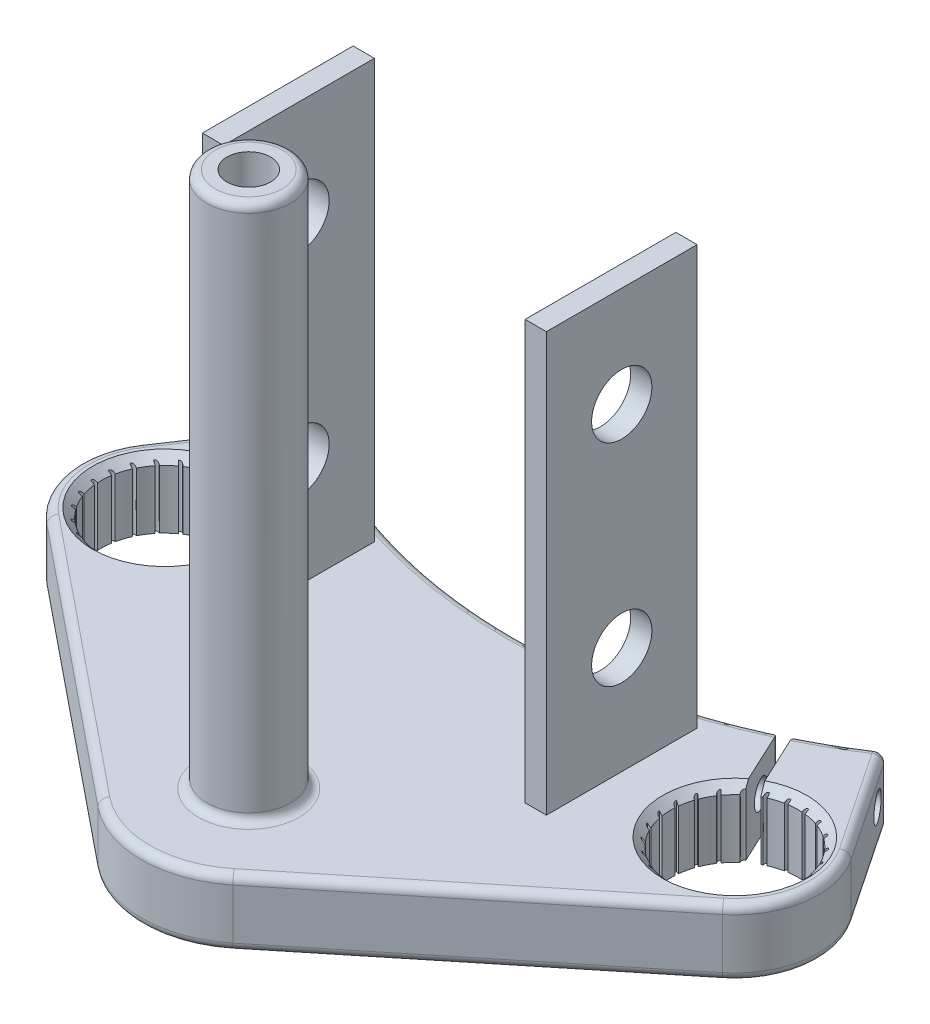
from build123d import *

# Parameters (mm, degrees)
BOSS_EXTRUDE1_DEPTH = 20
SKETCH2_R           = 12.5
BOSS_EXTRUDE2_DEPTH = 160
SKETCH4_W           = 6.35
SKETCH4_H           = 45
BOSS_EXTRUDE3_DEPTH = 125
HOLE1_START         = 155
HOLE1_OUTLINE_R     = 6.5
HOLE1_DEPTH         = 25
SKETCH7_R           = 4
CUT_EXTRUDE1_DEPTH  = 32
CHAMFER1_SIZE       = 2.5
SKETCH8_R           = 0.9
CUT_EXTRUDE2_DEPTH  = 215.909306453
CIRPATTERN1_DEPTH   = 18.399995043
SKETCH9_R           = 9
CUT_EXTRUDE3_DEPTH  = 259.708528077
FILLET1_R           = 2.5


# Read off the part's stored shape, not the designer's step: Hole1, CirPattern1
with BuildPart() as part:
    # Sketch1 → Boss-Extrude1 (new body)
    with BuildSketch(Plane(origin=(0, 0, 0), x_dir=(1, 0, 0), z_dir=(0, 1, 0))):
        with BuildLine():
            Line((100.846768223, -19.417499596), (20.155863325, -84.854399482))
            ThreePointArc((20.155863325, -84.854399482), (0, -92), (-20.155863325, -84.854399482))
            Line((-20.155863325, -84.854399482), (-100.846768223, -19.417499596))
            ThreePointArc((-100.846768223, -19.417499596), (-109.822166194, -3.716786069), (-105.860151048, 13.928967243))
            Line((-105.860151048, 13.928967243), (-84.688120838, 45.484396836))
            ThreePointArc((-84.688120838, 45.484396836), (-76.200585788, 40.186266039), (-67.382877527, 35.458003969))
            Line((-67.382877527, 35.458003969), (-76.111511905, 16.739387138))
            ThreePointArc((-76.111511905, 16.739387138), (-95.608640791, -15.829354653), (-73.16258288, 14.7816803))
            Line((-73.16258288, 14.7816803), (-64.227722255, 33.942550744))
            ThreePointArc((-64.227722255, 33.942550744), (0, 19.706115209), (64.227722255, 33.942550744))
            Line((64.227722255, 33.942550744), (73.16258288, 14.7816803))
            ThreePointArc((73.16258288, 14.7816803), (95.608640791, -15.829354653), (76.111511905, 16.739387138))
            Line((76.111511905, 16.739387138), (67.382877527, 35.458003969))
            ThreePointArc((67.382877527, 35.458003969), (76.200585788, 40.186266039), (84.688120838, 45.484396836))
            Line((84.688120838, 45.484396836), (105.860151048, 13.928967243))
            ThreePointArc((105.860151048, 13.928967243), (109.822166194, -3.716786069), (100.846768223, -19.417499596))
        make_face()
    extrude(amount=BOSS_EXTRUDE1_DEPTH)

    # Sketch2 → Boss-Extrude2 (add)
    with BuildSketch(Plane(origin=(0, 20, 0), x_dir=(1, 0, 0), z_dir=(0, 1, 0))):
        with Locations(Location((0, -60, 0), (0, 0, 90))):
            Circle(SKETCH2_R)
    extrude(amount=BOSS_EXTRUDE2_DEPTH)

    # Sketch4 → Boss-Extrude3 (add)
    with BuildSketch(Plane(origin=(0, 20, 0), x_dir=(1, 0, 0), z_dir=(0, 1, 0))):
        with Locations((48.175, 0)):
            Rectangle(SKETCH4_W, SKETCH4_H)
        with Locations((-48.175, 0)):
            Rectangle(SKETCH4_W, SKETCH4_H)
    extrude(amount=BOSS_EXTRUDE3_DEPTH)

    # Hole1 outline → Hole1 (cut)
    with BuildSketch(Plane(origin=(0, 0, 0), x_dir=(1, 0, 0), z_dir=(0, 1, 0)).offset(HOLE1_START)):
        with Locations((0, -60)):
            Circle(HOLE1_OUTLINE_R)
    extrude(amount=HOLE1_DEPTH, mode=Mode.SUBTRACT)

    # Sketch7 → Cut-Extrude1 (cut)
    with BuildSketch(Plane(origin=(79.442914997, 0, -53.302009129), x_dir=(-0.5571586897266951, 0, -0.830406041922885), z_dir=(0.830406041922885, 0, -0.5571586897266951))):
        with Locations((-18.414204496, 11)):
            Circle(SKETCH7_R)
    cut_extrude1 = extrude(amount=-CUT_EXTRUDE1_DEPTH, mode=Mode.SUBTRACT)

    # Mirror1: Cut-Extrude1 across plane
    add(cut_extrude1.mirror(Plane(origin=(0, 0, 0), x_dir=(0, 0, 1), z_dir=(1, 0, 0))), mode=Mode.SUBTRACT)

    # Chamfer1
    chamfer1_edges = [part.edges().sort_by_distance(p)[0] for p in [
        (95.608640791, 20, 15.829354653),
        (-95.608640791, 20, 15.829354653),
    ]]
    chamfer(chamfer1_edges, length=CHAMFER1_SIZE)

    # Sketch8 → Cut-Extrude2 (cut, through all)
    with BuildSketch(Plane(origin=(0, 20, 0), x_dir=(1, 0, 0), z_dir=(0, 1, 0))):
        with Locations((73.16258288, 14.7816803)):
            Circle(SKETCH8_R)
    cut_extrude2 = extrude(amount=-CUT_EXTRUDE2_DEPTH, mode=Mode.SUBTRACT)

    # CirPattern1 outline → CirPattern1 (cut)
    with BuildSketch(Plane(origin=(0, 0, 0), x_dir=(1, 0, 0), z_dir=(0, 1, 0))):
        with BuildLine():
            ThreePointArc((76.581318059, 16.983287608), (76.985943396, 17.180281878), (77.395120885, 17.367637658))
            Line((77.395120885, 17.367637658), (77.238837525, 18.253964636))
            ThreePointArc((77.238837525, 18.253964636), (76.595795024, 17.781253625), (76.581318059, 16.983287608))
        make_face()
        with BuildLine():
            ThreePointArc((81.267183388, 18.609393241), (81.70900732, 18.694950351), (82.152733668, 18.77001921))
            Line((82.152733668, 18.77001921), (82.231173837, 19.666594439))
            ThreePointArc((82.231173837, 19.666594439), (81.487695865, 19.376422311), (81.267183388, 18.609393241))
        make_face()
        with BuildLine():
            ThreePointArc((86.214248836, 18.967299478), (86.663161792, 18.935588852), (87.111197782, 18.893254972))
            Line((87.111197782, 18.893254972), (87.419015911, 19.738978332))
            ThreePointArc((87.419015911, 19.738978332), (86.625769264, 19.651119838), (86.214248836, 18.967299478))
        make_face()
        with BuildLine():
            ThreePointArc((91.085380066, 18.032615601), (91.51078937, 17.885798266), (91.93260209, 17.728946631))
            Line((91.93260209, 17.728946631), (92.448820883, 18.466183472))
            ThreePointArc((92.448820883, 18.466183472), (91.659864009, 18.586626023), (91.085380066, 18.032615601))
        make_face()
        with BuildLine():
            ThreePointArc((95.548617537, 15.869038771), (95.921532248, 15.617120085), (96.288375857, 15.356439875))
            Line((96.288375857, 15.356439875), (96.977815857, 15.934948725))
            ThreePointArc((96.977815857, 15.934948725), (96.246914862, 16.255484361), (95.548617537, 15.869038771))
        make_face()
        with BuildLine():
            ThreePointArc((99.299798989, 12.624013174), (99.594805586, 12.28416098), (99.881680299, 11.937417119))
            Line((99.881680299, 11.937417119), (100.697357309, 12.317773556))
            ThreePointArc((100.697357309, 12.317773556), (100.074321889, 12.816558303), (99.299798989, 12.624013174))
        make_face()
        with BuildLine():
            ThreePointArc((102.083287607, 8.518681941), (102.280281877, 8.114056604), (102.467637657, 7.704879114))
            Line((102.467637657, 7.704879114), (103.353964636, 7.861162475))
            ThreePointArc((103.353964636, 7.861162475), (102.881253625, 8.504204976), (102.083287607, 8.518681941))
        make_face()
        with BuildLine():
            ThreePointArc((103.70939324, 3.832816611), (103.79495035, 3.39099268), (103.870019209, 2.947266332))
            Line((103.870019209, 2.947266332), (104.766594439, 2.868826163))
            ThreePointArc((104.766594439, 2.868826163), (104.476422311, 3.612304135), (103.70939324, 3.832816611))
        make_face()
        with BuildLine():
            ThreePointArc((104.067299478, -1.114248836), (104.035588852, -1.563161792), (103.993254972, -2.011197782))
            Line((103.993254972, -2.011197782), (104.838978332, -2.319015911))
            ThreePointArc((104.838978332, -2.319015911), (104.751119838, -1.525769264), (104.067299478, -1.114248836))
        make_face()
        with BuildLine():
            ThreePointArc((103.132615601, -5.985380066), (102.985798266, -6.41078937), (102.828946631, -6.83260209))
            Line((102.828946631, -6.83260209), (103.566183472, -7.348820883))
            ThreePointArc((103.566183472, -7.348820883), (103.686626023, -6.559864009), (103.132615601, -5.985380066))
        make_face()
        with BuildLine():
            ThreePointArc((100.969038771, -10.448617537), (100.717120086, -10.821532248), (100.456439875, -11.188375857))
            Line((100.456439875, -11.188375857), (101.034948725, -11.877815857))
            ThreePointArc((101.034948725, -11.877815857), (101.355484361, -11.146914862), (100.969038771, -10.448617537))
        make_face()
        with BuildLine():
            ThreePointArc((97.724013174, -14.19979899), (97.38416098, -14.494805587), (97.03741712, -14.7816803))
            Line((97.03741712, -14.7816803), (97.417773556, -15.597357309))
            ThreePointArc((97.417773556, -15.597357309), (97.916558303, -14.974321889), (97.724013174, -14.19979899))
        make_face()
        with BuildLine():
            ThreePointArc((93.618681942, -16.983287608), (93.214056604, -17.180281878), (92.804879115, -17.367637658))
            Line((92.804879115, -17.367637658), (92.961162475, -18.253964636))
            ThreePointArc((92.961162475, -18.253964636), (93.604204976, -17.781253625), (93.618681942, -16.983287608))
        make_face()
        with BuildLine():
            ThreePointArc((88.932816612, -18.609393242), (88.49099268, -18.694950352), (88.047266332, -18.770019211))
            Line((88.047266332, -18.770019211), (87.968826163, -19.666594439))
            ThreePointArc((87.968826163, -19.666594439), (88.712304135, -19.376422311), (88.932816612, -18.609393242))
        make_face()
        with BuildLine():
            ThreePointArc((83.985751163, -18.96729948), (83.536838208, -18.935588854), (83.088802218, -18.893254974))
            Line((83.088802218, -18.893254974), (82.780984089, -19.738978332))
            ThreePointArc((82.780984089, -19.738978332), (83.574230736, -19.651119838), (83.985751163, -18.96729948))
        make_face()
        with BuildLine():
            ThreePointArc((79.114619933, -18.032615603), (78.689210629, -17.885798268), (78.26739791, -17.728946633))
            Line((78.26739791, -17.728946633), (77.751179117, -18.466183472))
            ThreePointArc((77.751179117, -18.466183472), (78.540135991, -18.586626023), (79.114619933, -18.032615603))
        make_face()
        with BuildLine():
            ThreePointArc((74.651382462, -15.869038773), (74.278467751, -15.617120087), (73.911624141, -15.356439877))
            Line((73.911624141, -15.356439877), (73.222184143, -15.934948725))
            ThreePointArc((73.222184143, -15.934948725), (73.953085138, -16.255484361), (74.651382462, -15.869038773))
        make_face()
        with BuildLine():
            ThreePointArc((70.900201009, -12.624013175), (70.605194412, -12.284160981), (70.318319699, -11.937417121))
            Line((70.318319699, -11.937417121), (69.502642691, -12.317773556))
            ThreePointArc((69.502642691, -12.317773556), (70.125678111, -12.816558303), (70.900201009, -12.624013175))
        make_face()
        with BuildLine():
            ThreePointArc((68.116712391, -8.518681942), (67.919718121, -8.114056605), (67.732362341, -7.704879116))
            Line((67.732362341, -7.704879116), (66.846035364, -7.861162475))
            ThreePointArc((66.846035364, -7.861162475), (67.318746375, -8.504204976), (68.116712391, -8.518681942))
        make_face()
        with BuildLine():
            ThreePointArc((66.490606757, -3.832816612), (66.405049647, -3.39099268), (66.329980788, -2.947266332))
            Line((66.329980788, -2.947266332), (65.433405561, -2.868826163))
            ThreePointArc((65.433405561, -2.868826163), (65.723577689, -3.612304135), (66.490606757, -3.832816612))
        make_face()
        with BuildLine():
            ThreePointArc((66.13270052, 1.114248837), (66.164411146, 1.563161792), (66.206745026, 2.011197782))
            Line((66.206745026, 2.011197782), (65.361021668, 2.319015911))
            ThreePointArc((65.361021668, 2.319015911), (65.448880162, 1.525769264), (66.13270052, 1.114248837))
        make_face()
        with BuildLine():
            ThreePointArc((67.067384397, 5.985380067), (67.214201732, 6.410789371), (67.371053367, 6.83260209))
            Line((67.371053367, 6.83260209), (66.633816528, 7.348820883))
            ThreePointArc((66.633816528, 7.348820883), (66.513373977, 6.559864009), (67.067384397, 5.985380067))
        make_face()
        with BuildLine():
            Line((69.743560124, 11.188375858), (69.165051275, 11.877815857))
            ThreePointArc((69.165051275, 11.877815857), (68.844515639, 11.146914862), (69.230961235, 10.448617533))
            ThreePointArc((69.230961235, 10.448617533), (69.482879913, 10.821532249), (69.743560124, 11.188375858))
        make_face()
    cirpattern1 = extrude(amount=CIRPATTERN1_DEPTH, mode=Mode.SUBTRACT)

    # Mirror3: Cut-Extrude2, CirPattern1 across plane
    add(cut_extrude2.mirror(Plane(origin=(0, 0, 0), x_dir=(0, 0, 1), z_dir=(1, 0, 0))), mode=Mode.SUBTRACT)
    add(cirpattern1.mirror(Plane(origin=(0, 0, 0), x_dir=(0, 0, 1), z_dir=(1, 0, 0))), mode=Mode.SUBTRACT)

    # Sketch9 → Cut-Extrude3 (cut, through all)
    with BuildSketch(Plane(origin=(51.35, 0, 0), x_dir=(0, 0, -1), z_dir=(1, 0, 0))):
        with Locations((0, 115)):
            Circle(SKETCH9_R)
        with Locations((0, 52)):
            Circle(SKETCH9_R)
    extrude(amount=-CUT_EXTRUDE3_DEPTH, mode=Mode.SUBTRACT)

    # Fillet1
    fillet1_edges = [part.edges().sort_by_distance(p)[0] for p in [
        (-109.822166194, 20, 3.716786069),
        (-60.501315774, 20, 52.135949539),
        (0, 0, -19.706115209),
        (76.200585788, 0, -40.186266039),
        (95.274135943, 0, -29.70668204),
        (109.822166194, 0, 3.716786069),
        (60.501315774, 0, 52.135949539),
        (0, 0, 92),
        (-60.501315774, 0, 52.135949539),
        (0, 20, 92),
        (-109.822166194, 0, 3.716786069),
        (-95.274135943, 0, -29.70668204),
        (-76.200585788, 0, -40.186266039),
        (60.501315774, 20, 52.135949539),
        (-67.382877527, 10, -35.458003969),
        (-64.227722255, 10, -33.942550744),
        (64.227722255, 10, -33.942550744),
        (67.382877527, 10, -35.458003969),
        (84.688120838, 10, -45.484396836),
        (-84.688120838, 10, -45.484396836),
        (109.822166194, 20, 3.716786069),
        (95.274135943, 20, -29.70668204),
        (76.200585788, 20, -40.186266039),
        (0, 20, 72.5),
        (0, 180, 72.5),
        (-76.200585788, 20, -40.186266039),
        (0, 20, -19.706115209),
        (-95.274135943, 20, -29.70668204),
    ]]
    fillet(fillet1_edges, radius=FILLET1_R)


solid = part.part
